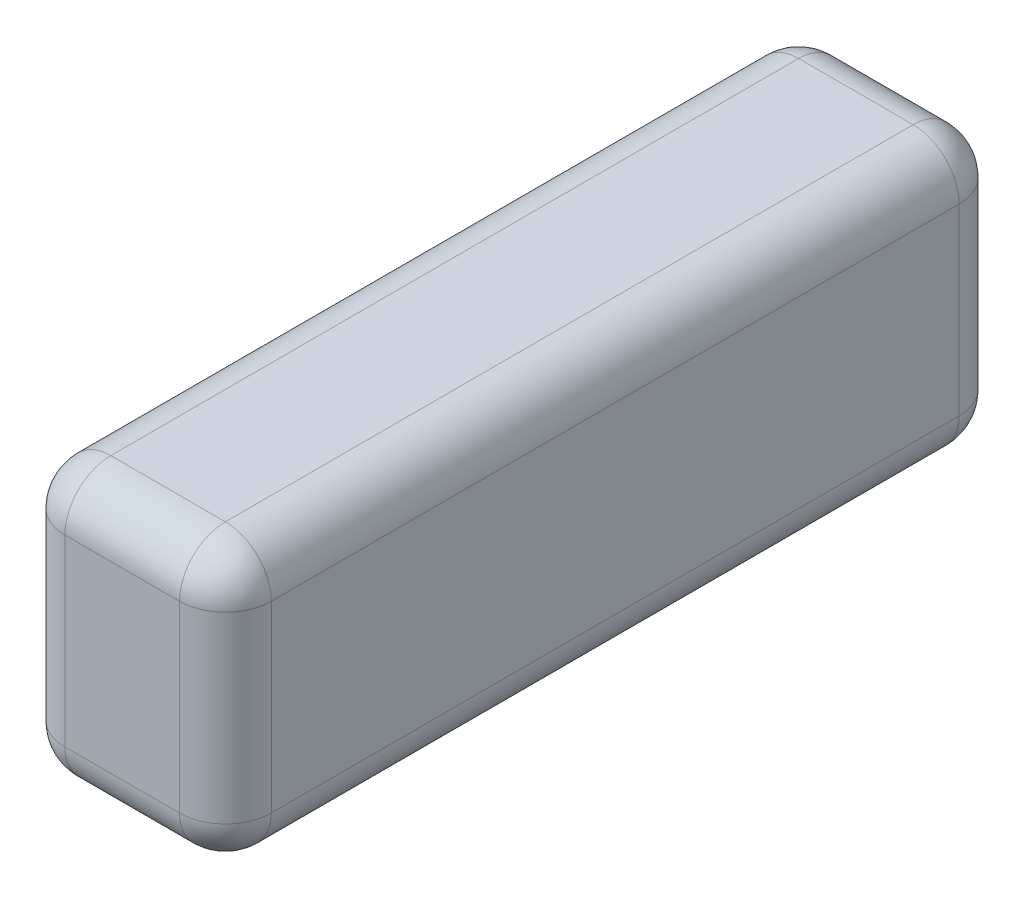
from build123d import *

# Parameters (mm, degrees)
ESQUISSE1_W        = 45
ESQUISSE1_H        = 60
BOSS_EXTRU_1_DEPTH = 170
CONG_1_R           = 10


with BuildPart() as part:
    # Esquisse1 → Boss.-Extru.1 (new body)
    with BuildSketch(Plane.XY):
        with Locations((22.5, 30)):
            Rectangle(ESQUISSE1_W, ESQUISSE1_H)
    extrude(amount=BOSS_EXTRU_1_DEPTH)

    # Congé1
    cong_1_edges = [part.edges().sort_by_distance(p)[0] for p in [
        (45, 30, 0),
        (45, 60, 85),
        (0, 60, 85),
        (22.5, 60, 0),
        (0, 0, 85),
        (45, 0, 85),
        (22.5, 0, 0),
        (22.5, 60, 170),
        (45, 30, 170),
        (22.5, 0, 170),
        (0, 30, 170),
        (0, 30, 0),
    ]]
    fillet(cong_1_edges, radius=CONG_1_R)


solid = part.part
